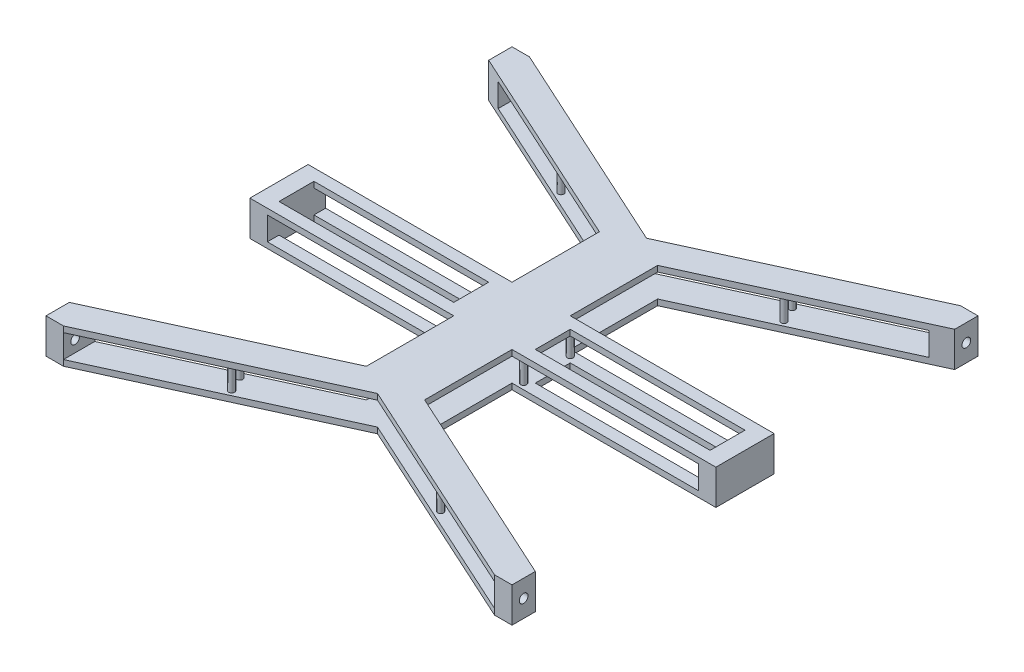
from build123d import *

# Parameters (mm, degrees)
BOSS_EXTRUDE1_DEPTH      = 6
BOSS_EXTRUDE1_DEPTH_BACK = 6
SKETCH2_W                = 148
SKETCH2_H                = 8
CUT_EXTRUDE1_DEPTH       = 160
SKETCH4_W                = 60
SKETCH4_H                = 12
CUT_EXTRUDE2_DEPTH       = 12
SKETCH5_R                = 1
BOSS_EXTRUDE2_DEPTH      = 8
CUT_EXTRUDE3_DEPTH       = 114.296072306
CUT_EXTRUDE3_DEPTH_BACK  = 114.296072306
SKETCH6_R                = 1.5


with BuildPart() as part:
    # Sketch1 → Boss-Extrude1 (new, two sides: drawn at the far end of the back side and taken through both)
    with BuildSketch(Plane(origin=(0, 0, 0), x_dir=(1, 0, 0), z_dir=(0, 1, 0)).offset(-BOSS_EXTRUDE1_DEPTH_BACK)):
        Polygon((80, 10), (80, -10), (10, -10), (10, -40), (80, -72), (80, -80), (74, -80), (0, -46.171428571), (-74, -80), (-80, -80), (-80, -72), (-10, -40), (-10, -10), (-80, -10), (-80, 10), (-10, 10), (-10, 40), (-80, 72), (-80, 80), (-74, 80), (0, 46.171428571), (74, 80), (80, 80), (80, 72), (10, 40), (10, 10), align=None)
    extrude(amount=BOSS_EXTRUDE1_DEPTH + BOSS_EXTRUDE1_DEPTH_BACK)

    # Sketch2 → Cut-Extrude1 (cut)
    with BuildSketch(Plane.XY.offset(80)):
        Rectangle(SKETCH2_W, SKETCH2_H)
    extrude(amount=-CUT_EXTRUDE1_DEPTH, mode=Mode.SUBTRACT)

    # Sketch4 → Cut-Extrude2 (cut)
    with BuildSketch(Plane(origin=(0, 6, 0), x_dir=(1, 0, 0), z_dir=(0, 1, 0))):
        with Locations((-44, 0)):
            Rectangle(SKETCH4_W, SKETCH4_H)
        with Locations((44, 0)):
            Rectangle(SKETCH4_W, SKETCH4_H)
    extrude(amount=-CUT_EXTRUDE2_DEPTH, mode=Mode.SUBTRACT)

    # Sketch5 → Boss-Extrude2 (add)
    with BuildSketch(Plane(origin=(0, -4, 0), x_dir=(1, 0, 0), z_dir=(0, 1, 0))):
        with Locations((-35.87258255, -60.371251291)):
            Circle(SKETCH5_R)
        with Locations((-38.271663698, -55.12326128)):
            Circle(SKETCH5_R)
        with Locations((-12, -8)):
            Circle(SKETCH5_R)
        with Locations((0, -40.171428571)):
            Circle(SKETCH5_R)
        with Locations((12, -8)):
            Circle(SKETCH5_R)
        with Locations((35.87258255, -60.371251291)):
            Circle(SKETCH5_R)
        with Locations((38.271663698, -55.12326128)):
            Circle(SKETCH5_R)
        with Locations((38.271663698, 55.12326128)):
            Circle(SKETCH5_R)
        with Locations((35.87258255, 60.371251291)):
            Circle(SKETCH5_R)
        with Locations((-35.87258255, 60.371251291)):
            Circle(SKETCH5_R)
        with Locations((-38.271663698, 55.12326128)):
            Circle(SKETCH5_R)
        with Locations((0, 40.171428571)):
            Circle(SKETCH5_R)
        with Locations((12, 8)):
            Circle(SKETCH5_R)
        with Locations((-12, 8)):
            Circle(SKETCH5_R)
    extrude(amount=BOSS_EXTRUDE2_DEPTH)

    # Sketch6 → Cut-Extrude3 (cut, two sides: drawn at the far end of the back side and taken through both)
    with BuildSketch(Plane(origin=(0, 0, 0), x_dir=(0, 0, -1), z_dir=(1, 0, 0)).offset(-CUT_EXTRUDE3_DEPTH_BACK)):
        with Locations((-76, 0)):
            Circle(SKETCH6_R)
        with Locations((76, 0)):
            Circle(SKETCH6_R)
    extrude(amount=CUT_EXTRUDE3_DEPTH + CUT_EXTRUDE3_DEPTH_BACK, mode=Mode.SUBTRACT)


solid = part.part
